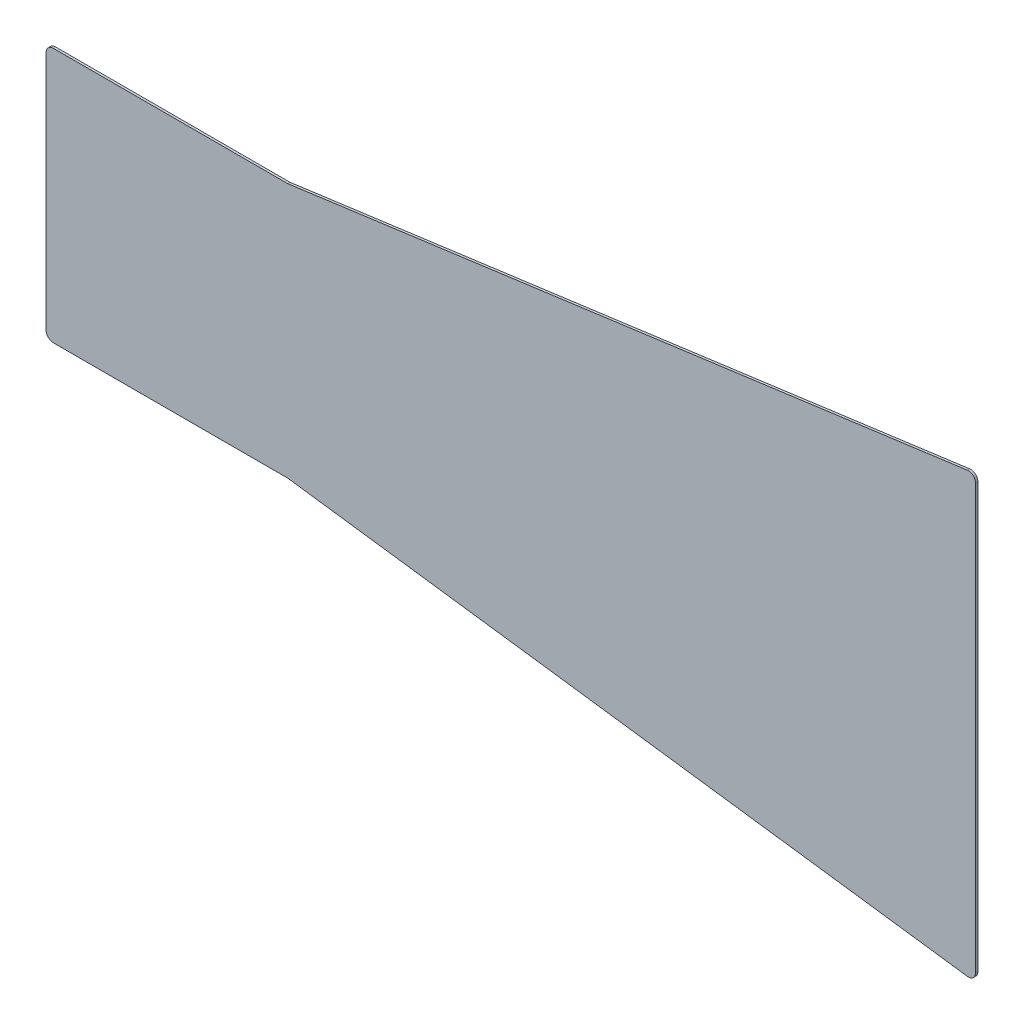
from build123d import *

# Parameters (mm, degrees)
BASE_FLANGE1_DEPTH = 3.175
FILLET1_R          = 10


# Sheet-metal steps are written as plain solids
with BuildPart() as part:
    # Sketch2 → Base-Flange1 (new body)
    with BuildSketch(Plane.XY):
        Polygon((-1276.361705331, -175.10923744), (-1276.361705331, 175.10923744), (-944.783937855, 175.10923744), (0, 302.529477003), (0, -302.529477003), (-944.783937855, -175.10923744), align=None)
    extrude(amount=-BASE_FLANGE1_DEPTH)

    # Fillet1
    fillet1_edges = [part.edges().sort_by_distance(p)[0] for p in [
        (0, 302.529477003, -1.5875),
        (0, -302.529477003, -1.5875),
        (-944.783937855, -175.10923744, -1.5875),
        (-1276.361705331, -175.10923744, -1.5875),
        (-1276.361705331, 175.10923744, -1.5875),
    ]]
    fillet(fillet1_edges, radius=FILLET1_R)


solid = part.part
